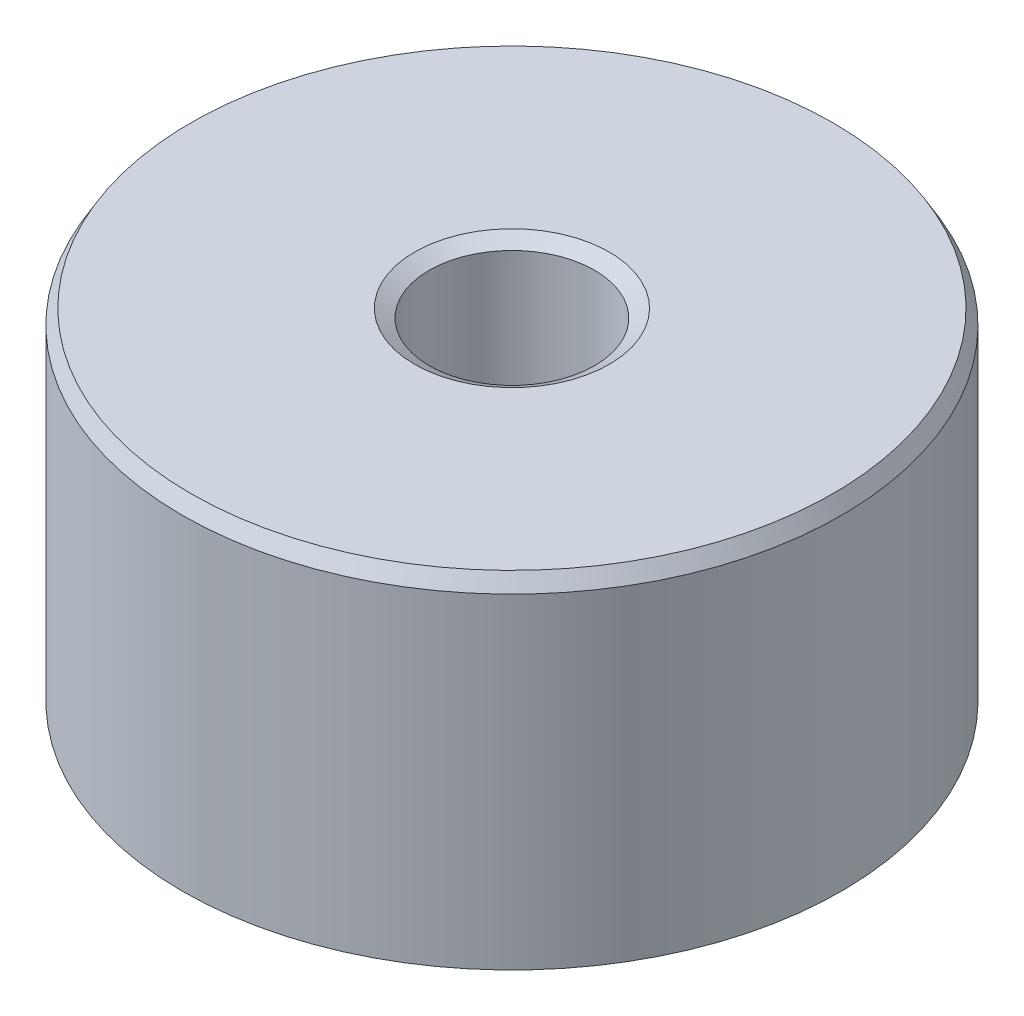
from build123d import *
from OCP.BRepFilletAPI import BRepFilletAPI_MakeChamfer

# Parameters (mm, degrees)
SKETCH1_R           = 5
BOSS_EXTRUDE1_DEPTH = 5.288240384
SKETCH2_R           = 1.254625105
CUT_EXTRUDE1_DEPTH  = 9.8298067
CHAMFER1_SIZE       = 0.221857445
CHAMFER1_SIZE2      = 0.128089456


with BuildPart() as part:
    # Sketch1 → Boss-Extrude1 (new body)
    with BuildSketch(Plane(origin=(0, 0, 0), x_dir=(1, 0, 0), z_dir=(0, 1, 0))):
        Circle(SKETCH1_R)
    extrude(amount=BOSS_EXTRUDE1_DEPTH)

    # Sketch2 → Cut-Extrude1 (cut, through all)
    with BuildSketch(Plane(origin=(0, 0, 0), x_dir=(1, 0, 0), z_dir=(0, 1, 0))):
        Circle(SKETCH2_R)
    extrude(amount=CUT_EXTRUDE1_DEPTH, mode=Mode.SUBTRACT)

    # Chamfer1: one chamfer whose edges measure the first distance from different faces: ONE call of the kernel's chamfer builder (chamfer() names one face for all edges)
    chamfer1_edges_1 = [part.edges().sort_by_distance(p)[0] for p in [
        (-1.254625105, 5.288240384, 0),
    ]]
    chamfer1_side_1 = [part.faces().sort_by_distance(p)[0] for p in [
        (-4.858578644, 5.288240384, 0),
    ]]
    chamfer1_edges_2 = [part.edges().sort_by_distance(p)[0] for p in [
        (-1.254625105, 0, 0),
    ]]
    chamfer1_side_2 = [part.faces().sort_by_distance(p)[0] for p in [
        (-1.254625105, 2.644120192, 0),
    ]]
    chamfer1_edges_3 = [part.edges().sort_by_distance(p)[0] for p in [
        (-5, 0, 0),
    ]]
    chamfer1_side_3 = [part.faces().sort_by_distance(p)[0] for p in [
        (-4.858578644, 0, 0),
    ]]
    chamfer1_edges_4 = [part.edges().sort_by_distance(p)[0] for p in [
        (-5, 5.288240384, 0),
    ]]
    chamfer1_side_4 = [part.faces().sort_by_distance(p)[0] for p in [
        (-5, 2.644120192, 0),
    ]]
    chamfer1 = BRepFilletAPI_MakeChamfer(part.part.solid().wrapped)
    for e in chamfer1_edges_1:
        chamfer1.Add(CHAMFER1_SIZE, CHAMFER1_SIZE2, e.wrapped, chamfer1_side_1[0].wrapped)  # the first distance lies on this face
    for e in chamfer1_edges_2:
        chamfer1.Add(CHAMFER1_SIZE, CHAMFER1_SIZE2, e.wrapped, chamfer1_side_2[0].wrapped)  # the first distance lies on this face
    for e in chamfer1_edges_3:
        chamfer1.Add(CHAMFER1_SIZE, CHAMFER1_SIZE2, e.wrapped, chamfer1_side_3[0].wrapped)  # the first distance lies on this face
    for e in chamfer1_edges_4:
        chamfer1.Add(CHAMFER1_SIZE, CHAMFER1_SIZE2, e.wrapped, chamfer1_side_4[0].wrapped)  # the first distance lies on this face
    add(Compound.cast(chamfer1.Shape()), mode=Mode.REPLACE)


solid = part.part
